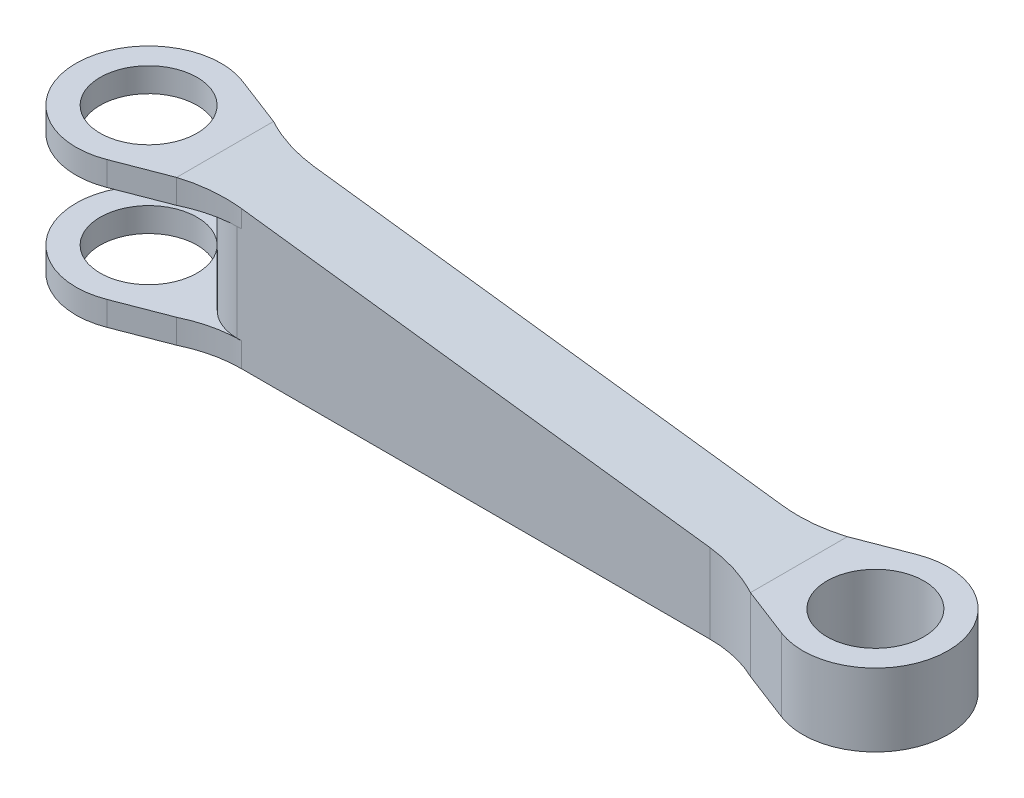
from build123d import *

# Parameters (mm, degrees)
SKETCH1_R           = 5.08
BOSS_EXTRUDE1_DEPTH = 7.62
SKETCH2_W           = 15.638324702
SKETCH2_H           = 10.16
CUT_EXTRUDE1_DEPTH  = 87.890649094
FILLET1_R           = 12.7
FILLET2_R           = 5.08


with BuildPart() as part:
    # Sketch1 → Boss-Extrude1 (new, symmetric)
    with BuildSketch(Plane(origin=(0, 0, 0), x_dir=(1, 0, 0), z_dir=(0, 1, 0))):
        with BuildLine():
            Line((2.735663722, 7.112), (8.018324702, 5.08))
            Line((8.018324702, 5.08), (8.018324702, 3.81))
            Line((8.018324702, 3.81), (68.181675298, 3.81))
            Line((68.181675298, 3.81), (68.181675298, 5.08))
            Line((68.181675298, 5.08), (73.464336278, 7.112))
            ThreePointArc((73.464336278, 7.112), (83.82, 0), (73.464336278, -7.112))
            Line((73.464336278, -7.112), (68.181675298, -5.08))
            Line((68.181675298, -5.08), (68.181675298, -3.81))
            Line((68.181675298, -3.81), (8.018324702, -3.81))
            Line((8.018324702, -3.81), (8.018324702, -5.08))
            Line((8.018324702, -5.08), (2.735663722, -7.112))
            ThreePointArc((2.735663722, -7.112), (-7.62, 0), (2.735663722, 7.112))
        make_face()
        with Locations(Location((0, 0, 0), (0, 0, 90))):
            Circle(SKETCH1_R, mode=Mode.SUBTRACT)
        with Locations(Location((76.2, 0, 0), (0, 0, 90))):
            Circle(SKETCH1_R, mode=Mode.SUBTRACT)
    extrude(amount=BOSS_EXTRUDE1_DEPTH, both=True)

    # Sketch2 → Cut-Extrude1 (cut, through all)
    with BuildSketch(Plane.XY.offset(13.97)):
        Polygon((8.018324702, 7.62), (68.181675298, 0), (83.82, 0), (83.82, 7.62), align=None)
        with Locations((0.199162351, 0)):
            Rectangle(SKETCH2_W, SKETCH2_H)
    extrude(amount=-CUT_EXTRUDE1_DEPTH, mode=Mode.SUBTRACT)

    # Fillet1
    # the kernel refuses this fillet: 12.7 mm, written as the material it adds along each edge
    with BuildSketch(Plane(origin=(68.181675298, 13.839504146, 3.81), x_dir=(-1, 0, 0), z_dir=(0, -1, 0))) as fillet1_piece_1_section:
        with BuildLine():
            CenterArc((5.535801658, -12.7), FILLET1_R, 90, 25.841932763)
            Line((0, -1.27), (0, 0))
            Line((0, 0), (5.535801658, 0))
        make_face()
    fillet1_piece_1 = extrude(amount=21.459504146, mode=Mode.PRIVATE)
    fillet1_piece_1 = split(fillet1_piece_1, bisect_by=Plane(origin=(64.458294063, 0.471585521, 3.912132652), z_dir=(-0.12565136927087708, -0.9920744596048997, 0)), keep=Keep.TOP, mode=Mode.PRIVATE)
    add(fillet1_piece_1)
    with BuildSketch(Plane(origin=(68.181675298, 13.839504146, -3.81), x_dir=(0, 0, -1), z_dir=(0, -1, 0))) as fillet1_piece_2_section:
        with BuildLine():
            CenterArc((12.7, -5.535801658), FILLET1_R, 154.158067237, 25.841932763)
            Line((0, -5.535801658), (0, 0))
            Line((0, 0), (1.27, 0))
        make_face()
    fillet1_piece_2 = extrude(amount=21.459504146, mode=Mode.PRIVATE)
    fillet1_piece_2 = split(fillet1_piece_2, bisect_by=Plane(origin=(67.224480553, 0.121233673, -4.63296), z_dir=(-0.12565136927087708, -0.9920744596048997, 0)), keep=Keep.TOP, mode=Mode.PRIVATE)
    add(fillet1_piece_2)
    with BuildSketch(Plane(origin=(8.018324702, 8.759504146, -3.81), x_dir=(1, 0, 0), z_dir=(0, -1, 0))) as fillet1_piece_3_section:
        with BuildLine():
            CenterArc((5.535801658, -12.7), FILLET1_R, 90, 25.841932763)
            Line((0, -1.27), (0, 0))
            Line((0, 0), (5.535801658, 0))
        make_face()
    fillet1_piece_3 = extrude(amount=30.219008291, mode=Mode.PRIVATE)
    fillet1_piece_3 = split(fillet1_piece_3, bisect_by=Plane(origin=(11.757033309, 5.08, -3.912132652), z_dir=(0, 1, 0)), keep=Keep.TOP, mode=Mode.PRIVATE)
    fillet1_piece_3 = split(fillet1_piece_3, bisect_by=Plane(origin=(11.871985872, 7.131913851, -3.912132652), z_dir=(-0.12565136927087708, -0.9920744596048997, 0)), keep=Keep.TOP, mode=Mode.PRIVATE)
    add(fillet1_piece_3)
    with BuildSketch(Plane(origin=(8.018324702, -5.08, -3.81), x_dir=(1, 0, 0), z_dir=(0, -1, 0))) as fillet1_piece_4:
        with BuildLine():
            CenterArc((5.535801658, -12.7), FILLET1_R, 90, 25.841932763)
            Line((0, -1.27), (0, 0))
            Line((0, 0), (5.535801658, 0))
        make_face()
    extrude(amount=2.54)
    with BuildSketch(Plane(origin=(8.018324702, 21.459504146, -3.81), x_dir=(0, 0, -1), z_dir=(0, -1, 0))) as fillet1_piece_5_section:
        with BuildLine():
            CenterArc((12.7, 5.535801658), FILLET1_R, 180, 25.841932763)
            Line((0, 5.535801658), (0, 0))
            Line((0, 0), (1.27, 0))
        make_face()
    fillet1_piece_5 = extrude(amount=16.379504146, mode=Mode.PRIVATE)
    fillet1_piece_5 = split(fillet1_piece_5, bisect_by=Plane(origin=(9.128609354, 7.479376698, -4.63296), z_dir=(-0.12565136927087708, -0.9920744596048997, 0)), keep=Keep.TOP, mode=Mode.PRIVATE)
    add(fillet1_piece_5)
    with BuildSketch(Plane(origin=(8.018324702, 21.459504146, -3.81), x_dir=(0, 0, -1), z_dir=(0, -1, 0))) as fillet1_piece_6_section:
        with BuildLine():
            CenterArc((12.7, 5.535801658), FILLET1_R, 180, 25.841932763)
            Line((0, 5.535801658), (0, 0))
            Line((0, 0), (1.27, 0))
        make_face()
    fillet1_piece_6 = extrude(amount=30.219008291, mode=Mode.PRIVATE)
    fillet1_piece_6 = split(fillet1_piece_6, bisect_by=Plane(origin=(8.985567945, -7.62, -4.63296), z_dir=(0, 1, 0)), keep=Keep.TOP, mode=Mode.PRIVATE)
    fillet1_piece_6 = split(fillet1_piece_6, bisect_by=Plane(origin=(8.985567945, -5.08, -4.63296), z_dir=(0, -1, 0)), keep=Keep.TOP, mode=Mode.PRIVATE)
    add(fillet1_piece_6)
    with BuildSketch(Plane(origin=(8.018324702, 21.459504146, 3.81), x_dir=(0, 0, 1), z_dir=(0, -1, 0))) as fillet1_piece_7_section:
        with BuildLine():
            CenterArc((12.7, -5.535801658), FILLET1_R, 154.158067237, 25.841932763)
            Line((0, -5.535801658), (0, 0))
            Line((0, 0), (1.27, 0))
        make_face()
    fillet1_piece_7 = extrude(amount=16.379504146, mode=Mode.PRIVATE)
    fillet1_piece_7 = split(fillet1_piece_7, bisect_by=Plane(origin=(9.128609354, 7.479376698, 4.63296), z_dir=(-0.12565136927087708, -0.9920744596048997, 0)), keep=Keep.TOP, mode=Mode.PRIVATE)
    add(fillet1_piece_7)
    with BuildSketch(Plane(origin=(8.018324702, 21.459504146, 3.81), x_dir=(0, 0, 1), z_dir=(0, -1, 0))) as fillet1_piece_8_section:
        with BuildLine():
            CenterArc((12.7, -5.535801658), FILLET1_R, 154.158067237, 25.841932763)
            Line((0, -5.535801658), (0, 0))
            Line((0, 0), (1.27, 0))
        make_face()
    fillet1_piece_8 = extrude(amount=30.219008291, mode=Mode.PRIVATE)
    fillet1_piece_8 = split(fillet1_piece_8, bisect_by=Plane(origin=(8.985567945, -7.62, 4.63296), z_dir=(0, 1, 0)), keep=Keep.TOP, mode=Mode.PRIVATE)
    fillet1_piece_8 = split(fillet1_piece_8, bisect_by=Plane(origin=(8.985567945, -5.08, 4.63296), z_dir=(0, -1, 0)), keep=Keep.TOP, mode=Mode.PRIVATE)
    add(fillet1_piece_8)
    with BuildSketch(Plane(origin=(8.018324702, 8.759504146, 3.81), x_dir=(0, 0, 1), z_dir=(0, -1, 0))) as fillet1_piece_9_section:
        with BuildLine():
            CenterArc((12.7, -5.535801658), FILLET1_R, 154.158067237, 25.841932763)
            Line((0, -5.535801658), (0, 0))
            Line((0, 0), (1.27, 0))
        make_face()
    fillet1_piece_9 = extrude(amount=30.219008291, mode=Mode.PRIVATE)
    fillet1_piece_9 = split(fillet1_piece_9, bisect_by=Plane(origin=(8.985567945, 5.08, 4.63296), z_dir=(0, 1, 0)), keep=Keep.TOP, mode=Mode.PRIVATE)
    fillet1_piece_9 = split(fillet1_piece_9, bisect_by=Plane(origin=(9.128609354, 7.479376698, 4.63296), z_dir=(-0.12565136927087708, -0.9920744596048997, 0)), keep=Keep.TOP, mode=Mode.PRIVATE)
    add(fillet1_piece_9)
    with BuildSketch(Plane(origin=(8.018324702, -5.08, 3.81), x_dir=(0, 0, 1), z_dir=(0, -1, 0))) as fillet1_piece_10:
        with BuildLine():
            CenterArc((12.7, -5.535801658), FILLET1_R, 154.158067237, 25.841932763)
            Line((0, -5.535801658), (0, 0))
            Line((0, 0), (1.27, 0))
        make_face()
    extrude(amount=2.54)

    # Fillet2
    # the kernel refuses this fillet: 5.08 mm, written as the material it takes off along each edge
    with BuildSketch(Plane(origin=(8.018324702, 5.08, -3.81), x_dir=(0, 0, 1), z_dir=(0, -1, 0)), Plane(origin=(8.018324702, 5.08, 3.81), x_dir=(1, 0, 0), z_dir=(0, -1, 0))) as fillet2_piece_1:
        with BuildLine():
            CenterArc((FILLET2_R, -FILLET2_R), FILLET2_R, 90, 90)
            Line((0, -FILLET2_R), (0, 0))
            Line((0, 0), (FILLET2_R, 0))
        make_face()
    extrude(amount=10.16, mode=Mode.SUBTRACT)


solid = part.part
